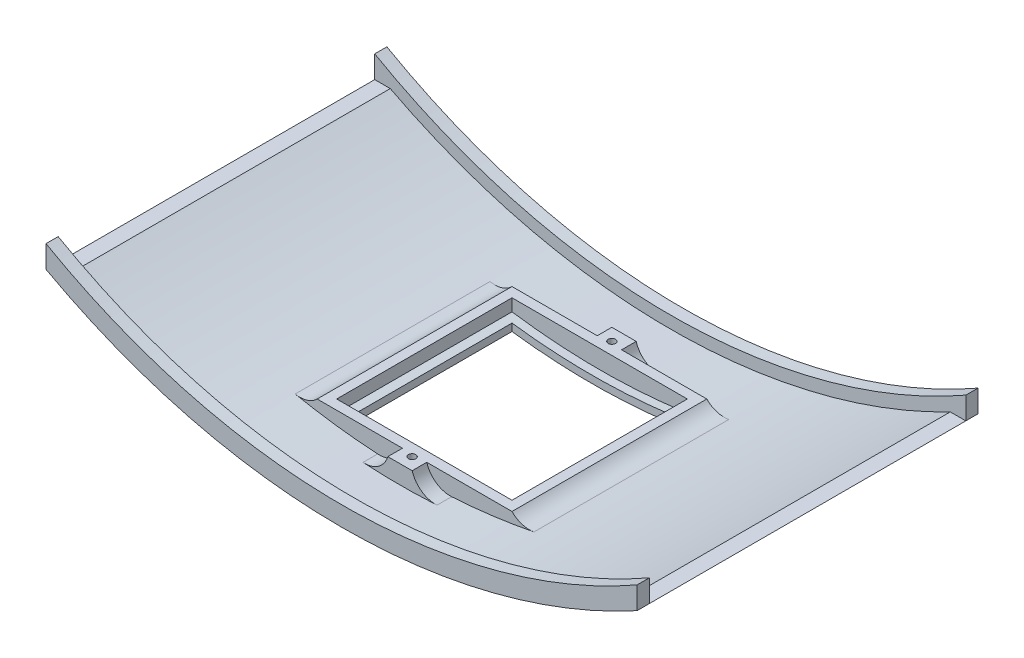
from build123d import *

# Parameters (mm, degrees)
ESTRUSIONE_ESTRUSIONE1_DEPTH = 140
ESTRUSIONE_ESTRUSIONE2_START = -5
ESTRUSIONE_ESTRUSIONE2_DEPTH = 5
ESTRUSIONE_ESTRUSIONE3_DEPTH = 5
SCHIZZO4_W                   = 65
SCHIZZO4_H                   = 65
TAGLIO_ESTRUSIONE1_DEPTH     = 190.601391721
SCHIZZO6_W                   = 80
SCHIZZO6_H                   = 80
SCHIZZO6_W_2                 = 72
SCHIZZO6_H_2                 = 72
ESTRUSIONE_ESTRUSIONE5_DEPTH = 10.61
SCHIZZO8_W                   = 10
SCHIZZO8_H                   = 6
ESTRUSIONE_ESTRUSIONE6_DEPTH = 8
SCHIZZO9_R                   = 1.5
TAGLIO_ESTRUSIONE2_DEPTH     = 5
TAGLIO_ESTRUSIONE3_DEPTH     = 314.596874984
RACCORDO1_R                  = 10


with BuildPart() as part:
    # Schizzo1 → Estrusione-Estrusione1 (new body)
    with BuildSketch(Plane.XY):
        with BuildLine():
            Line((121.383689184, -221.979728804), (115, -221.979728804))
            ThreePointArc((115, -221.979728804), (0, -250), (-115, -221.979728804))
            Line((-115, -221.979728804), (-121.383689184, -221.979728804))
            ThreePointArc((-121.383689184, -221.979728804), (0, -253), (121.383689184, -221.979728804))
        make_face()
    extrude(amount=ESTRUSIONE_ESTRUSIONE1_DEPTH)

    # Schizzo2 → Estrusione-Estrusione2 (add)
    with BuildSketch(Plane.XY.offset(140).offset(ESTRUSIONE_ESTRUSIONE2_START)):
        with BuildLine():
            Line((-121.383689184, -218.554341069), (-121.383689184, -221.979728804))
            Line((-121.383689184, -221.979728804), (-115, -221.979728804))
            ThreePointArc((-115, -221.979728804), (-118.204253089, -220.290159906), (-121.383689184, -218.554341069))
        make_face()
        with BuildLine():
            Line((-121.383689184, -212.816822643), (-121.383689184, -218.554341069))
            ThreePointArc((-121.383689184, -218.554341069), (-118.204253089, -220.290159906), (-115, -221.979728804))
            ThreePointArc((-115, -221.979728804), (0, -250), (115, -221.979728804))
            ThreePointArc((115, -221.979728804), (118.204253089, -220.290159906), (121.383689184, -218.554341069))
            Line((121.383689184, -218.554341069), (121.383689184, -212.816822643))
            ThreePointArc((121.383689184, -212.816822643), (0, -245), (-121.383689184, -212.816822643))
        make_face()
        with BuildLine():
            Line((115, -221.979728804), (121.383689184, -221.979728804))
            Line((121.383689184, -221.979728804), (121.383689184, -218.554341069))
            ThreePointArc((121.383689184, -218.554341069), (118.204253089, -220.290159906), (115, -221.979728804))
        make_face()
    extrude(amount=ESTRUSIONE_ESTRUSIONE2_DEPTH)

    # Schizzo3 → Estrusione-Estrusione3 (add)
    with BuildSketch(Plane(origin=(0, 0, 0), x_dir=(-1, 0, 0), z_dir=(0, 0, -1))):
        with BuildLine():
            Line((-121.383689184, -212.816822643), (-121.383689184, -218.554341069))
            ThreePointArc((-121.383689184, -218.554341069), (-118.204253089, -220.290159906), (-115, -221.979728804))
            ThreePointArc((-115, -221.979728804), (0, -250), (115, -221.979728804))
            ThreePointArc((115, -221.979728804), (118.204253089, -220.290159906), (121.383689184, -218.554341069))
            Line((121.383689184, -218.554341069), (121.383689184, -212.816822643))
            ThreePointArc((121.383689184, -212.816822643), (0, -245), (-121.383689184, -212.816822643))
        make_face()
        with BuildLine():
            Line((115, -221.979728804), (121.383689184, -221.979728804))
            Line((121.383689184, -221.979728804), (121.383689184, -218.554341069))
            ThreePointArc((121.383689184, -218.554341069), (118.204253089, -220.290159906), (115, -221.979728804))
        make_face()
        with BuildLine():
            Line((-121.383689184, -218.554341069), (-121.383689184, -221.979728804))
            Line((-121.383689184, -221.979728804), (-115, -221.979728804))
            ThreePointArc((-115, -221.979728804), (-118.204253089, -220.290159906), (-121.383689184, -218.554341069))
        make_face()
    extrude(amount=-ESTRUSIONE_ESTRUSIONE3_DEPTH)

    # Schizzo4 → Taglio-Estrusione1 (cut, through all)
    with BuildSketch(Plane(origin=(0, -253, 0), x_dir=(-1, 0, 0), z_dir=(0, -1, 0))):
        with Locations((0, -70)):
            Rectangle(SCHIZZO4_W, SCHIZZO4_H)
    extrude(amount=-TAGLIO_ESTRUSIONE1_DEPTH, mode=Mode.SUBTRACT)

    # Schizzo6 → Estrusione-Estrusione5 (add)
    with BuildSketch(Plane(origin=(0, -253, 0), x_dir=(-1, 0, 0), z_dir=(0, -1, 0))):
        with Locations((0, -70)):
            Rectangle(SCHIZZO6_W, SCHIZZO6_H)
        with Locations((0, -70)):
            Rectangle(SCHIZZO6_W_2, SCHIZZO6_H_2, mode=Mode.SUBTRACT)
    extrude(amount=-ESTRUSIONE_ESTRUSIONE5_DEPTH)

    # Schizzo8 → Estrusione-Estrusione6 (add)
    with BuildSketch(Plane(origin=(0, -242.39, 0), x_dir=(1, 0, 0), z_dir=(0, 1, 0))):
        with Locations((0, -27)):
            Rectangle(SCHIZZO8_W, SCHIZZO8_H)
        with Locations((0, -113)):
            Rectangle(SCHIZZO8_W, SCHIZZO8_H)
    extrude(amount=-ESTRUSIONE_ESTRUSIONE6_DEPTH)

    # Schizzo9 → Taglio-Estrusione2 (cut)
    with BuildSketch(Plane(origin=(0, -242.39, 0), x_dir=(1, 0, 0), z_dir=(0, 1, 0))):
        with Locations(Location((0, -29, 0), (0, 0, 270))):
            Circle(SCHIZZO9_R)
        with Locations(Location((0, -111, 0), (0, 0, 270))):
            Circle(SCHIZZO9_R)
    extrude(amount=-TAGLIO_ESTRUSIONE2_DEPTH, mode=Mode.SUBTRACT)

    # Schizzo10 → Taglio-Estrusione3 (cut, through all)
    with BuildSketch(Plane(origin=(0, 0, 0), x_dir=(-1, 0, 0), z_dir=(0, 0, -1))):
        with BuildLine():
            Line((-121.383689184, -295.114305534), (125.369855002, -295.114305534))
            Line((125.369855002, -295.114305534), (121.383689184, -221.979728804))
            ThreePointArc((121.383689184, -221.979728804), (0, -253), (-121.383689184, -221.979728804))
            Line((-121.383689184, -221.979728804), (-121.383689184, -295.114305534))
        make_face()
    extrude(amount=-TAGLIO_ESTRUSIONE3_DEPTH, mode=Mode.SUBTRACT)

    # Raccordo1
    # the kernel refuses this fillet: 10 mm, written as the material it adds along each edge
    with BuildSketch(Plane(origin=(5, -249.949994999, 55.515759856), x_dir=(0.999183410527211, 0.04040435777500708, 0), z_dir=(0, 0, -1))) as raccordo1_piece_1_section:
        with BuildLine():
            CenterArc((10.002177863, -9.99791641), RACCORDO1_R, 88.830362483, 77.02269885)
            Line((0.305456743, -7.553821587), (0, 0))
            ThreePointArc((0, 0), (5.103151971, 0.052089747), (10.206303942, 0))
        make_face()
    raccordo1_piece_1 = extrude(amount=31.515759856, mode=Mode.PRIVATE)
    raccordo1_piece_1 = split(raccordo1_piece_1, bisect_by=Plane(origin=(10.036552928, -248.481695624, 34), z_dir=(0, 0, -1)), keep=Keep.TOP, mode=Mode.PRIVATE)
    add(raccordo1_piece_1)
    with BuildSketch(Plane(origin=(40, -246.779253585, 110), x_dir=(0.9840071168859134, 0.17812914954569523, 0), z_dir=(0, 0, -1))) as raccordo1_piece_2:
        with BuildLine():
            CenterArc((9.012656027, -9.998308312), RACCORDO1_R, 88.946089238, 56.448243915)
            Line((0.781854008, -4.319056766), (0, 0))
            ThreePointArc((0, 0), (4.598293891, 0.042292191), (9.196587782, 0))
        make_face()
    extrude(amount=80)
    with BuildSketch(Plane(origin=(5, -249.949994999, 116), x_dir=(0.9991834105272109, 0.04040435777500963, 0), z_dir=(0, 0, -1))) as raccordo1_piece_3_section:
        with BuildLine():
            CenterArc((10.002177863, -9.99791641), RACCORDO1_R, 88.830362483, 77.02269885)
            Line((0.305456743, -7.553821587), (0, 0))
            ThreePointArc((0, 0), (5.103151971, 0.052089747), (10.206303942, 0))
        make_face()
    raccordo1_piece_3 = extrude(amount=31.515759856, mode=Mode.PRIVATE)
    raccordo1_piece_3 = split(raccordo1_piece_3, bisect_by=Plane(origin=(10.036552928, -248.481695624, 106), z_dir=(0, 0, 1)), keep=Keep.TOP, mode=Mode.PRIVATE)
    add(raccordo1_piece_3)
    with BuildSketch(Plane(origin=(-5, -249.949994999, 116), x_dir=(-0.9991834105272109, 0.04040435777501259, 0), z_dir=(0, 0, -1))) as raccordo1_piece_4_section:
        with BuildLine():
            CenterArc((10.002177863, 9.99791641), RACCORDO1_R, 194.146938667, 77.02269885)
            Line((0.305456743, 7.553821587), (0, 0))
            ThreePointArc((0, 0), (5.103151971, -0.052089747), (10.206303942, 0))
        make_face()
    raccordo1_piece_4 = extrude(amount=31.515759856, mode=Mode.PRIVATE)
    raccordo1_piece_4 = split(raccordo1_piece_4, bisect_by=Plane(origin=(-10.036552928, -248.481695624, 106), z_dir=(0, 0, 1)), keep=Keep.TOP, mode=Mode.PRIVATE)
    add(raccordo1_piece_4)
    with BuildSketch(Plane(origin=(-40, -246.779253585, 110), x_dir=(-0.9840071168859144, 0.17812914954568923, 0), z_dir=(0, 0, -1))) as raccordo1_piece_5:
        with BuildLine():
            CenterArc((9.012656027, 9.998308312), RACCORDO1_R, 214.605666847, 56.448243915)
            Line((0.781854008, 4.319056766), (0, 0))
            ThreePointArc((0, 0), (4.598293891, -0.042292191), (9.196587782, 0))
        make_face()
    extrude(amount=80)
    with BuildSketch(Plane(origin=(-5, -249.949994999, 55.515759856), x_dir=(-0.9991834105272107, 0.040404357775012466, 0), z_dir=(0, 0, -1))) as raccordo1_piece_6_section:
        with BuildLine():
            CenterArc((10.002177863, 9.99791641), RACCORDO1_R, 194.146938667, 77.02269885)
            Line((0.305456743, 7.553821587), (0, 0))
            ThreePointArc((0, 0), (5.103151971, -0.052089747), (10.206303942, 0))
        make_face()
    raccordo1_piece_6 = extrude(amount=31.515759856, mode=Mode.PRIVATE)
    raccordo1_piece_6 = split(raccordo1_piece_6, bisect_by=Plane(origin=(-10.036552928, -248.481695624, 34), z_dir=(0, 0, -1)), keep=Keep.TOP, mode=Mode.PRIVATE)
    add(raccordo1_piece_6)


solid = part.part
